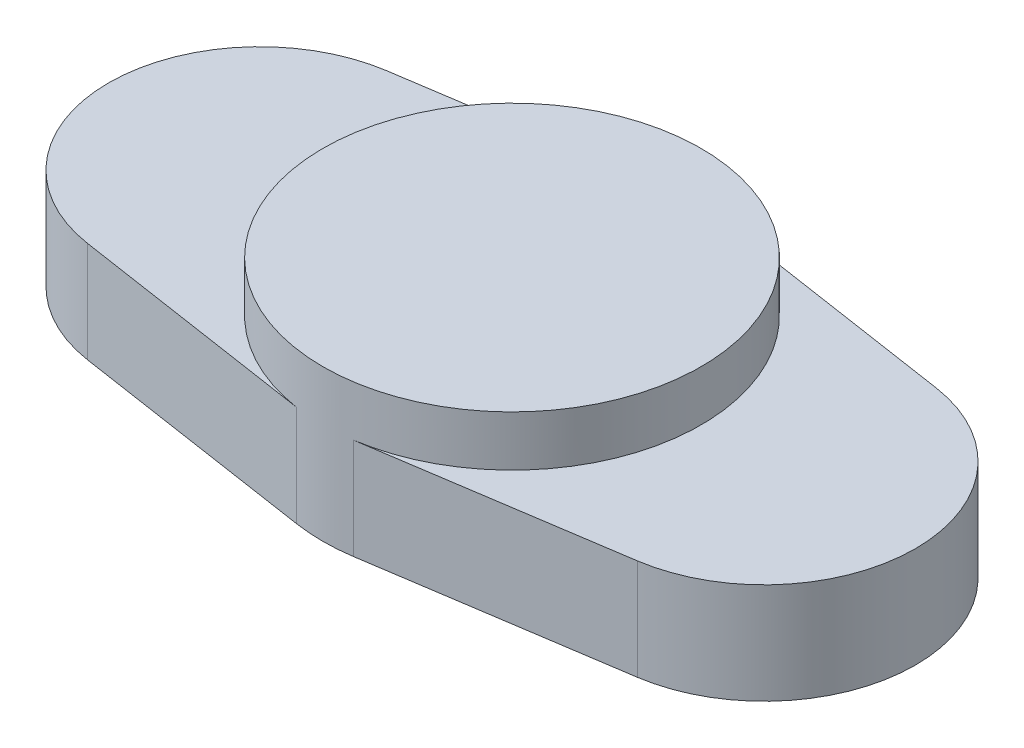
from build123d import *
from build123d.topology import SkipClean

# Parameters (mm, degrees)
BOSS_EXTRUDE1_DEPTH = 2
SKETCH2_R           = 3.75
BOSS_EXTRUDE2_DEPTH = 1
SKETCH3_R           = 2.75
CUT_EXTRUDE1_DEPTH  = 1


with BuildPart() as part:
    # Sketch1 → Boss-Extrude1 (new body)
    with BuildSketch(Plane(origin=(0, 0, 0), x_dir=(1, 0, 0), z_dir=(0, 1, 0))):
        with BuildLine():
            Line((0.5625, 3.707572487), (5.45, 2.96605799))
            ThreePointArc((5.45, 2.96605799), (8, 0), (5.45, -2.96605799))
            Line((5.45, -2.96605799), (0.5625, -3.707572487))
            ThreePointArc((0.5625, -3.707572487), (0, -3.75), (-0.5625, -3.707572487))
            Line((-0.5625, -3.707572487), (-5.45, -2.96605799))
            ThreePointArc((-5.45, -2.96605799), (-8, 0), (-5.45, 2.96605799))
            Line((-5.45, 2.96605799), (-0.5625, 3.707572487))
            ThreePointArc((-0.5625, 3.707572487), (0, 3.75), (0.5625, 3.707572487))
        make_face()
    extrude(amount=BOSS_EXTRUDE1_DEPTH)

    # Sketch2 → Boss-Extrude2 (add)
    with SkipClean():  # the faces are left unmerged after this step: merging them gives an invalid solid
        with BuildSketch(Plane(origin=(0, 2, 0), x_dir=(1, 0, 0), z_dir=(0, 1, 0))):
            Circle(SKETCH2_R)
        extrude(amount=BOSS_EXTRUDE2_DEPTH)
    add(part.part.scale(1), mode=Mode.REPLACE)  # the faces are merged on a copy

    # Sketch3 → Cut-Extrude1 (cut)
    with BuildSketch(Plane.XZ):
        Circle(SKETCH3_R)
    extrude(amount=-CUT_EXTRUDE1_DEPTH, mode=Mode.SUBTRACT)


solid = part.part
